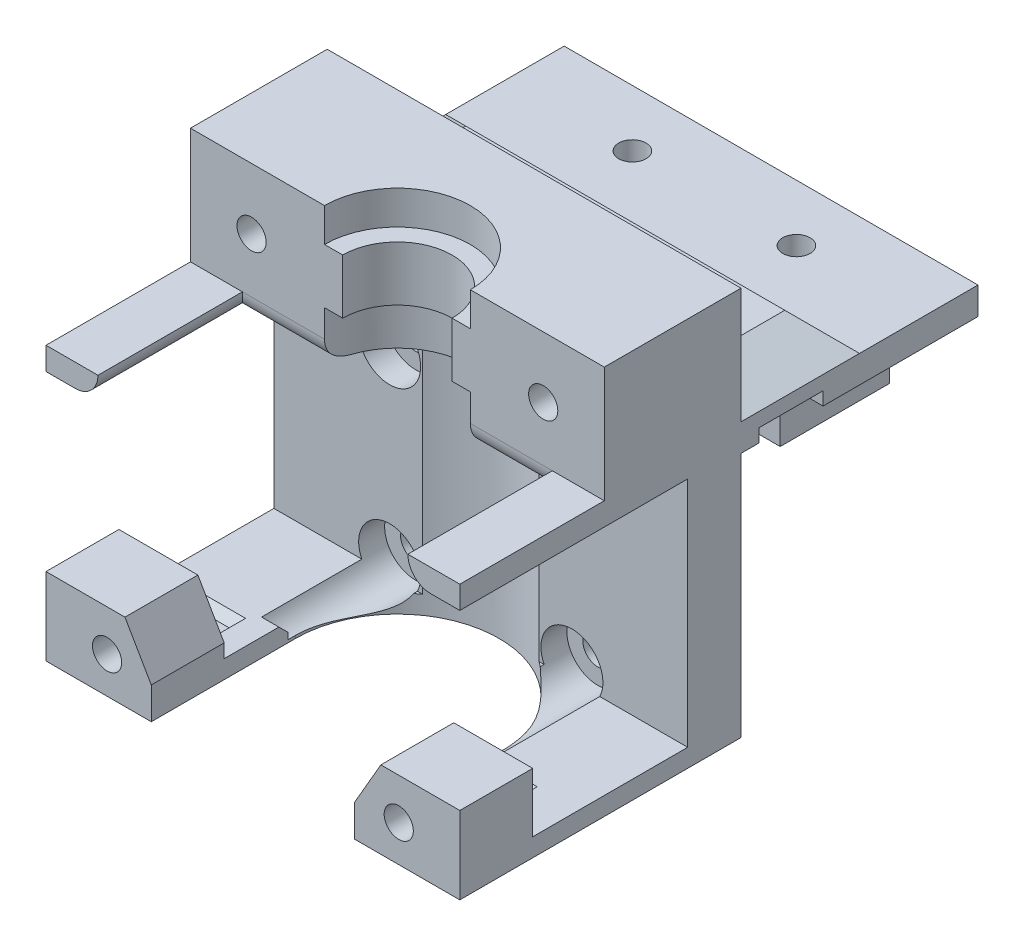
from build123d import *
from OCP.BRepFilletAPI import BRepFilletAPI_MakeChamfer

# Parameters (mm, degrees)
SKETCH1_W                = 45.4
SKETCH1_H                = 27
BOSS_EXTRUDE1_DEPTH      = 5.85
SKETCH3_W                = 45.4
SKETCH3_H                = 5.85
BOSS_EXTRUDE2_DEPTH      = 3
SKETCH4_W                = 45.4
SKETCH4_H                = 2.5
BOSS_EXTRUDE3_DEPTH      = 25
SKETCH6_W                = 45.4
SKETCH6_H                = 2
BOSS_EXTRUDE5_DEPTH      = 25
SKETCH7_R                = 1.65
CUT_EXTRUDE1_DEPTH       = 10
CUT_EXTRUDE2_DEPTH       = 10
CUT_EXTRUDE2_DEPTH_BACK  = 2.85
SKETCH8_R                = 3.4
SKETCH37_W               = 45.4
SKETCH37_H               = 15
BOSS_EXTRUDE16_DEPTH     = 12.7
CUT_EXTRUDE3_DEPTH       = 69.332806909
CUT_EXTRUDE4_DEPTH       = 62.393261076
SKETCH18_W               = 45.4
SKETCH18_H               = 3
BOSS_EXTRUDE8_DEPTH      = 26
SKETCH19_W               = 26
SKETCH19_H               = 12
BOSS_EXTRUDE9_DEPTH      = 11.2
SKETCH20_R               = 1.5
CUT_EXTRUDE9_DEPTH       = 62.1268558
SKETCH21_W               = 45.4
SKETCH21_H               = 10
BOSS_EXTRUDE10_DEPTH     = 3
SKETCH22_W               = 7
SKETCH22_H               = 1.45
CUT_EXTRUDE10_DEPTH      = 70.542594861
SKETCH23_W               = 3
SKETCH23_H               = 7
CUT_EXTRUDE11_DEPTH      = 10
SKETCH24_W               = 19.4
SKETCH24_H               = 7
BOSS_EXTRUDE11_DEPTH     = 1.45
CHAMFER2_SIZE            = 3
CHAMFER2_SIZE2           = 5.196152423
CHAMFER3_SIZE            = 3
CHAMFER4_SIZE            = 2.1
SKETCH35_W               = 7.6
SKETCH35_H               = 1.5
CUT_EXTRUDE14_DEPTH      = 12
FILLET8_R                = 10
SKETCH36_R               = 11.15
CUT_EXTRUDE15_DEPTH      = 25.5
SKETCH39_R               = 8
SKETCH39_R_2             = 6
BOSS_EXTRUDE17_DEPTH     = 6
SKETCH40_W               = 45.4
SKETCH40_H               = 10
CUT_EXTRUDE16_DEPTH      = 63.553037544
SKETCH41_R               = 1.6
CUT_EXTRUDE17_DEPTH      = 75.601943674
CUT_EXTRUDE18_DEPTH      = 18
CUT_EXTRUDE18_DEPTH_BACK = 4
SKETCH43_W               = 11.55
SKETCH43_H               = 6.5
BOSS_EXTRUDE18_DEPTH     = 8
SKETCH44_R               = 1.6
CUT_EXTRUDE19_DEPTH      = 10
CUT_EXTRUDE20_DEPTH      = 4
CUT_EXTRUDE20_DEPTH_BACK = 4
CUT_EXTRUDE21_DEPTH      = 80.18820935
SKETCH47_W               = 9
SKETCH47_H               = 15.85
CUT_EXTRUDE22_DEPTH      = 4
FILLET11_R               = 2.5
CHAMFER7_SIZE            = 1


# Some blends are built 0.0001 mm under size
with BuildPart() as part:
    # Sketch1 → Boss-Extrude1 (new body)
    with BuildSketch(Plane.XY):
        with Locations((22.7, 13.5)):
            Rectangle(SKETCH1_W, SKETCH1_H)
    extrude(amount=BOSS_EXTRUDE1_DEPTH)

    # Sketch3 → Boss-Extrude2 (add)
    with BuildSketch(Plane(origin=(0, 27, 0), x_dir=(1, 0, 0), z_dir=(0, 1, 0))):
        with Locations((22.7, -2.925)):
            Rectangle(SKETCH3_W, SKETCH3_H)
    extrude(amount=BOSS_EXTRUDE2_DEPTH)

    # Sketch4 → Boss-Extrude3 (add)
    with BuildSketch(Plane.XY.offset(5.85)):
        with Locations((22.7, 28.75)):
            Rectangle(SKETCH4_W, SKETCH4_H)
    extrude(amount=BOSS_EXTRUDE3_DEPTH)

    # Sketch6 → Boss-Extrude5 (add)
    with BuildSketch(Plane.XY.offset(5.85)):
        with Locations((22.7, 1)):
            Rectangle(SKETCH6_W, SKETCH6_H)
    extrude(amount=BOSS_EXTRUDE5_DEPTH)

    # Sketch7 → Cut-Extrude1 (cut)
    with BuildSketch(Plane.XY.offset(5.85)):
        with Locations((12.7, 23.5)):
            Circle(SKETCH7_R)
        with Locations((32.7, 23.5)):
            Circle(SKETCH7_R)
        with Locations(Location((32.7, 3.5, 0), (0, 0, 294.619977329))):
            Circle(SKETCH7_R)
        with Locations(Location((12.7, 3.5, 0), (0, 0, 294.619977329))):
            Circle(SKETCH7_R)
    extrude(amount=-CUT_EXTRUDE1_DEPTH, mode=Mode.SUBTRACT)

    # Sketch8 → Cut-Extrude2 (cut, two sides: drawn at the far end of the back side and taken through both)
    with BuildSketch(Plane.XY.offset(5.85).offset(-CUT_EXTRUDE2_DEPTH_BACK)):
        with Locations(Location((12.7, 23.5, 0), (0, 0, 180))):
            Circle(SKETCH8_R)
        with Locations(Location((32.7, 23.5, 0), (0, 0, 180))):
            Circle(SKETCH8_R)
        with Locations(Location((32.7, 3.5, 0), (0, 0, 180))):
            Circle(SKETCH8_R)
        with Locations(Location((12.7, 3.5, 0), (0, 0, 180))):
            Circle(SKETCH8_R)
    extrude(amount=CUT_EXTRUDE2_DEPTH + CUT_EXTRUDE2_DEPTH_BACK, mode=Mode.SUBTRACT)

    # Sketch37 → Boss-Extrude16 (add)
    with BuildSketch(Plane(origin=(0, 30, 0), x_dir=(1, 0, 0), z_dir=(0, 1, 0))):
        with Locations((22.7, -7.5)):
            Rectangle(SKETCH37_W, SKETCH37_H)
    extrude(amount=BOSS_EXTRUDE16_DEPTH)

    # Sketch9 → Cut-Extrude3 (cut, through all)
    with BuildSketch(Plane(origin=(0, 2, 0), x_dir=(1, 0, 0), z_dir=(0, 1, 0))):
        with BuildLine():
            Line((11.55, -15), (11.55, -30.85))
            Line((11.55, -30.85), (33.85, -30.85))
            Line((33.85, -30.85), (33.85, -15))
            ThreePointArc((33.85, -15), (22.7, -3.85), (11.55, -15))
        make_face()
    extrude(amount=-CUT_EXTRUDE3_DEPTH, mode=Mode.SUBTRACT)

    # Sketch10 → Cut-Extrude4 (cut, through all)
    with BuildSketch(Plane.XZ.offset(-27.5)):
        with BuildLine():
            Line((14.7, 15), (14.7, 30.85))
            Line((14.7, 30.85), (30.7, 30.85))
            Line((30.7, 30.85), (30.7, 15))
            ThreePointArc((30.7, 15), (22.7, 7), (14.7, 15))
        make_face()
    extrude(amount=-CUT_EXTRUDE4_DEPTH, mode=Mode.SUBTRACT)

    # Sketch18 → Boss-Extrude8 (add)
    with BuildSketch(Plane(origin=(0, 0, 0), x_dir=(-1, 0, 0), z_dir=(0, 0, -1))):
        with Locations((-22.7, 28.5)):
            Rectangle(SKETCH18_W, SKETCH18_H)
    extrude(amount=BOSS_EXTRUDE8_DEPTH)

    # Sketch19 → Boss-Extrude9 (add)
    with BuildSketch(Plane.XZ.offset(-27)):
        with Locations((22.7, -20)):
            Rectangle(SKETCH19_W, SKETCH19_H)
    extrude(amount=BOSS_EXTRUDE9_DEPTH)

    # Sketch20 → Cut-Extrude9 (cut, through all)
    with BuildSketch(Plane.XZ.offset(-15.8)):
        with Locations(Location((31.697973531, -19.782705683, 0), (0, 0, 270))):
            Circle(SKETCH20_R)
        with Locations(Location((13.699854881, -19.782705683, 0), (0, 0, 270))):
            Circle(SKETCH20_R)
    extrude(amount=-CUT_EXTRUDE9_DEPTH, mode=Mode.SUBTRACT)

    # Sketch21 → Boss-Extrude10 (add)
    with BuildSketch(Plane(origin=(0, 30, 0), x_dir=(1, 0, 0), z_dir=(0, 1, 0))):
        with Locations((22.7, 5)):
            Rectangle(SKETCH21_W, SKETCH21_H)
    extrude(amount=BOSS_EXTRUDE10_DEPTH)

    # Sketch22 → Cut-Extrude10 (cut, through all)
    with BuildSketch(Plane(origin=(45.4, 0, 0), x_dir=(0, 0, -1), z_dir=(1, 0, 0))):
        with Locations((5.5, 27.725)):
            Rectangle(SKETCH22_W, SKETCH22_H)
    extrude(amount=-CUT_EXTRUDE10_DEPTH, mode=Mode.SUBTRACT)

    # Sketch23 → Cut-Extrude11 (cut)
    with BuildSketch(Plane.XZ.offset(-28.45)):
        with Locations((11.5, -5.5)):
            Rectangle(SKETCH23_W, SKETCH23_H)
        with Locations((33.9, -5.5)):
            Rectangle(SKETCH23_W, SKETCH23_H)
    extrude(amount=-CUT_EXTRUDE11_DEPTH, mode=Mode.SUBTRACT)

    # Sketch24 → Boss-Extrude11 (add)
    with BuildSketch(Plane.XZ.offset(-28.45)):
        with Locations((22.7, -5.5)):
            Rectangle(SKETCH24_W, SKETCH24_H)
    extrude(amount=BOSS_EXTRUDE11_DEPTH)

    # Chamfer1
    # the kernel refuses this chamfer: 8 mm, written as the material it takes off along each edge
    with BuildSketch(Plane(origin=(32.4, 33, -2), x_dir=(-1, 0, 0), z_dir=(0, 0, -1)), Plane(origin=(13, 33, -9), x_dir=(1, 0, 0), z_dir=(0, 0, 1))) as chamfer1_piece_1:
        with BuildLine():
            Line((8.22627417, 0.22627417), (-0.22627417, -8.22627417))
            Line((-0.22627417, -8.22627417), (-0.38627417, -8.22627417))
            ThreePointArc((-0.38627417, -8.22627417), (-0.16, -4.113137085), (-0.16, 0))
            Line((-0.16, 0), (0, 0.16))
            ThreePointArc((0, 0.16), (4.113137085, 0.16), (8.22627417, 0.38627417))
            Line((8.22627417, 0.38627417), (8.22627417, 0.22627417))
        make_face()
    extrude(amount=7, mode=Mode.SUBTRACT)

    # Chamfer2: one chamfer whose edges measure the first distance from different faces: ONE call of the kernel's chamfer builder (chamfer() names one face for all edges)
    chamfer2_edges_1 = [part.edges().sort_by_distance(p)[0] for p in [
        (45.4, 33, -5),
    ]]
    chamfer2_side_1 = [part.faces().sort_by_distance(p)[0] for p in [
        (45.4, 24.795074607, 5.028693502),
    ]]
    chamfer2_edges_2 = [part.edges().sort_by_distance(p)[0] for p in [
        (0, 33, -5),
    ]]
    chamfer2_side_2 = [part.faces().sort_by_distance(p)[0] for p in [
        (0, 24.795074607, 5.028693502),
    ]]
    chamfer2 = BRepFilletAPI_MakeChamfer(part.part.solid().wrapped)
    for e in chamfer2_edges_1:
        chamfer2.Add(CHAMFER2_SIZE, CHAMFER2_SIZE2, e.wrapped, chamfer2_side_1[0].wrapped)  # the first distance lies on this face
    for e in chamfer2_edges_2:
        chamfer2.Add(CHAMFER2_SIZE, CHAMFER2_SIZE2, e.wrapped, chamfer2_side_2[0].wrapped)  # the first distance lies on this face
    add(Compound.cast(chamfer2.Shape()), mode=Mode.REPLACE)

    # Chamfer3
    chamfer3_edges = [part.edges().sort_by_distance(p)[0] for p in [
        (22.7, 30, -10),
    ]]
    chamfer(chamfer3_edges, length=CHAMFER3_SIZE - 0.0001)  # a hair under: the kernel refuses the full size

    # Chamfer4
    chamfer4_edges = [part.edges().sort_by_distance(p)[0] for p in [
        (35.7, 27, -20),
        (9.7, 27, -20),
    ]]
    chamfer(chamfer4_edges, length=CHAMFER4_SIZE)

    # Sketch35 → Cut-Extrude14 (cut)
    with BuildSketch(Plane(origin=(0, 0, -26), x_dir=(-1, 0, 0), z_dir=(0, 0, -1))):
        with Locations((-3.8, 27.75)):
            Rectangle(SKETCH35_W, SKETCH35_H)
    extrude(amount=-CUT_EXTRUDE14_DEPTH, mode=Mode.SUBTRACT)

    # Fillet8
    # the kernel refuses this fillet: 10 mm, written as the material it adds along each edge
    with BuildSketch(Plane(origin=(7.6, 28.5, -26), x_dir=(-1, 0, 0), z_dir=(0, 0, 1))) as fillet8_piece_1:
        with BuildLine():
            CenterArc((5.267826876, 10), FILLET8_R, 238.211669383, 31.788330617)
            Line((0, 1.5), (0, 0))
            Line((0, 0), (5.267826876, 0))
        make_face()
    extrude(amount=12)

    # Sketch36 → Cut-Extrude15 (cut)
    with BuildSketch(Plane.XZ.offset(-27.5)):
        with Locations((22.7, 15)):
            Circle(SKETCH36_R)
    extrude(amount=CUT_EXTRUDE15_DEPTH, mode=Mode.SUBTRACT)

    # Sketch39 → Boss-Extrude17 (add)
    with BuildSketch(Plane(origin=(0, 33, 0), x_dir=(1, 0, 0), z_dir=(0, 1, 0))):
        with Locations((22.7, -15)):
            Circle(SKETCH39_R)
        with Locations(Location((22.7, -15, 0), (0, 0, 270))):
            Circle(SKETCH39_R_2, mode=Mode.SUBTRACT)
    extrude(amount=BOSS_EXTRUDE17_DEPTH)

    # Sketch40 → Cut-Extrude16 (cut, through all)
    with BuildSketch(Plane(origin=(0, 30, 0), x_dir=(1, 0, 0), z_dir=(0, 1, 0))):
        with Locations((22.7, -20)):
            Rectangle(SKETCH40_W, SKETCH40_H)
    extrude(amount=CUT_EXTRUDE16_DEPTH, mode=Mode.SUBTRACT)

    # Sketch41 → Cut-Extrude17 (cut, through all)
    with BuildSketch(Plane.XY.offset(15)):
        with Locations((6.7, 36)):
            Circle(SKETCH41_R)
        with Locations((38.7, 36)):
            Circle(SKETCH41_R)
    extrude(amount=-CUT_EXTRUDE17_DEPTH, mode=Mode.SUBTRACT)

    # Sketch42 → Cut-Extrude18 (cut, two sides: drawn at the far end of the back side and taken through both)
    with BuildSketch(Plane(origin=(0, 0, 0), x_dir=(-1, 0, 0), z_dir=(0, 0, -1)).offset(-CUT_EXTRUDE18_DEPTH_BACK)):
        Polygon((-40.374315781, 38.9), (-42.048631561, 36), (-40.374315781, 33.1), (-37.025684219, 33.1), (-35.351368439, 36), (-37.025684219, 38.9), align=None)
        Polygon((-8.374315781, 38.9), (-10.048631561, 36), (-8.374315781, 33.1), (-5.025684219, 33.1), (-3.351368439, 36), (-5.025684219, 38.9), align=None)
    extrude(amount=CUT_EXTRUDE18_DEPTH + CUT_EXTRUDE18_DEPTH_BACK, mode=Mode.SUBTRACT)

    # Sketch43 → Boss-Extrude18 (add)
    with BuildSketch(Plane.XY.offset(30.85)):
        with Locations((5.775, 5.25)):
            Rectangle(SKETCH43_W, SKETCH43_H)
        with Locations((39.625, 5.25)):
            Rectangle(SKETCH43_W, SKETCH43_H)
    extrude(amount=-BOSS_EXTRUDE18_DEPTH)

    # Sketch44 → Cut-Extrude19 (cut)
    with BuildSketch(Plane.XY.offset(30.85)):
        with Locations((6.7, 4)):
            Circle(SKETCH44_R)
        with Locations((38.7, 4)):
            Circle(SKETCH44_R)
    extrude(amount=-CUT_EXTRUDE19_DEPTH, mode=Mode.SUBTRACT)

    # Sketch45 → Cut-Extrude20 (cut, two sides: drawn at the far end of the back side and taken through both)
    with BuildSketch(Plane(origin=(0, 0, 22.85), x_dir=(-1, 0, 0), z_dir=(0, 0, -1)).offset(-CUT_EXTRUDE20_DEPTH_BACK)):
        Polygon((-40.374315781, 6.9), (-42.048631561, 4), (-40.374315781, 1.1), (-37.025684219, 1.1), (-35.351368439, 4), (-37.025684219, 6.9), align=None)
        Polygon((-8.374315781, 6.9), (-10.048631561, 4), (-8.374315781, 1.1), (-5.025684219, 1.1), (-3.351368439, 4), (-5.025684219, 6.9), align=None)
    extrude(amount=CUT_EXTRUDE20_DEPTH + CUT_EXTRUDE20_DEPTH_BACK, mode=Mode.SUBTRACT)

    # Sketch46 → Cut-Extrude21 (cut, through all)
    with BuildSketch(Plane(origin=(0, 0, 22.85), x_dir=(-1, 0, 0), z_dir=(0, 0, -1))):
        Polygon((-36.736751346, 8.5), (-33.85, 3.5), (-33.85, 8.5), align=None)
        Polygon((-11.55, 8.5), (-8.663248654, 8.5), (-11.55, 3.5), align=None)
    extrude(amount=-CUT_EXTRUDE21_DEPTH, mode=Mode.SUBTRACT)

    # Sketch47 → Cut-Extrude22 (cut)
    with BuildSketch(Plane.XZ.offset(-27.5)):
        with Locations((10.2, 22.925)):
            Rectangle(SKETCH47_W, SKETCH47_H)
        with Locations((35.2, 22.925)):
            Rectangle(SKETCH47_W, SKETCH47_H)
    extrude(amount=-CUT_EXTRUDE22_DEPTH, mode=Mode.SUBTRACT)

    # Fillet11
    fillet11_edges = [part.edges().sort_by_distance(p)[0] for p in [
        (10.2, 27.5, 15),
        (35.2, 27.5, 15),
        (39.7, 27.5, 22.925),
        (5.7, 27.5, 22.925),
    ]]
    fillet(fillet11_edges, radius=FILLET11_R - 0.0001)  # a hair under: the kernel refuses the full size

    # Chamfer7
    # the kernel refuses this chamfer: 1 mm, written as the material it takes off along each edge
    with BuildSketch(Plane(origin=(14.121682988, 2, 15.85), x_dir=(0, 0, 1), z_dir=(-1, 0, 0))) as chamfer7_piece_1_section:
        Polygon((CHAMFER7_SIZE, 0), (0, -CHAMFER7_SIZE), (0, 0), align=None)
    chamfer7_piece_1 = extrude(amount=7.044595236, mode=Mode.PRIVATE)
    chamfer7_piece_1 = chamfer7_piece_1 & Plane(origin=(12.7, 3.5, 15.85), x_dir=(-1, 0, 0), z_dir=(0, 0, 1)) * Cylinder(3.4, 19, mode=Mode.PRIVATE)
    add(chamfer7_piece_1, mode=Mode.SUBTRACT)
    with BuildSketch(Plane(origin=(38.322912248, 2, 15.85), x_dir=(0, 0, 1), z_dir=(-1, 0, 0))) as chamfer7_piece_2_section:
        Polygon((CHAMFER7_SIZE, 0), (0, -CHAMFER7_SIZE), (0, 0), align=None)
    chamfer7_piece_2 = extrude(amount=7.044595236, mode=Mode.PRIVATE)
    chamfer7_piece_2 = chamfer7_piece_2 & Plane(origin=(32.7, 3.5, 15.85), x_dir=(-1, 0, 0), z_dir=(0, 0, 1)) * Cylinder(3.4, 19, mode=Mode.PRIVATE)
    add(chamfer7_piece_2, mode=Mode.SUBTRACT)
    with BuildSketch(Plane(origin=(33.934385989, 2, 18.85), x_dir=(0, 0, -1), z_dir=(1, 0, 0))) as chamfer7_piece_3_section:
        Polygon((CHAMFER7_SIZE, 0), (0, -CHAMFER7_SIZE), (0, 0), align=None)
    chamfer7_piece_3 = extrude(amount=9.531228022, mode=Mode.PRIVATE)
    chamfer7_piece_3 = split(chamfer7_piece_3, bisect_by=Plane(origin=(35.86314823, 3.113571399, 18.85), z_dir=(0.8660254037844388, 0.4999999999999997, 0)), keep=Keep.TOP, mode=Mode.PRIVATE)
    chamfer7_piece_3 = split(chamfer7_piece_3, bisect_by=Plane(origin=(39.154044764, -1.013571399, 18.85), z_dir=(-0.8660254037844384, 0.5000000000000007, 0)), keep=Keep.TOP, mode=Mode.PRIVATE)
    chamfer7_piece_3 = split(chamfer7_piece_3, bisect_by=Plane(origin=(33.934385989, 1.1, 18.85), z_dir=(0, 1, 0)), keep=Keep.TOP, mode=Mode.PRIVATE)
    add(chamfer7_piece_3, mode=Mode.SUBTRACT)
    with BuildSketch(Plane(origin=(1.934385989, 2, 18.85), x_dir=(0, 0, -1), z_dir=(1, 0, 0))) as chamfer7_piece_4_section:
        Polygon((CHAMFER7_SIZE, 0), (0, -CHAMFER7_SIZE), (0, 0), align=None)
    chamfer7_piece_4 = extrude(amount=9.531228022, mode=Mode.PRIVATE)
    chamfer7_piece_4 = split(chamfer7_piece_4, bisect_by=Plane(origin=(3.86314823, 3.113571399, 18.85), z_dir=(0.8660254037844382, 0.5000000000000009, 0)), keep=Keep.TOP, mode=Mode.PRIVATE)
    chamfer7_piece_4 = split(chamfer7_piece_4, bisect_by=Plane(origin=(1.934385989, 1.1, 18.85), z_dir=(0, 1, 0)), keep=Keep.TOP, mode=Mode.PRIVATE)
    chamfer7_piece_4 = split(chamfer7_piece_4, bisect_by=Plane(origin=(7.154044764, -1.013571399, 18.85), z_dir=(-0.8660254037844392, 0.49999999999999906, 0)), keep=Keep.TOP, mode=Mode.PRIVATE)
    add(chamfer7_piece_4, mode=Mode.SUBTRACT)


solid = part.part
